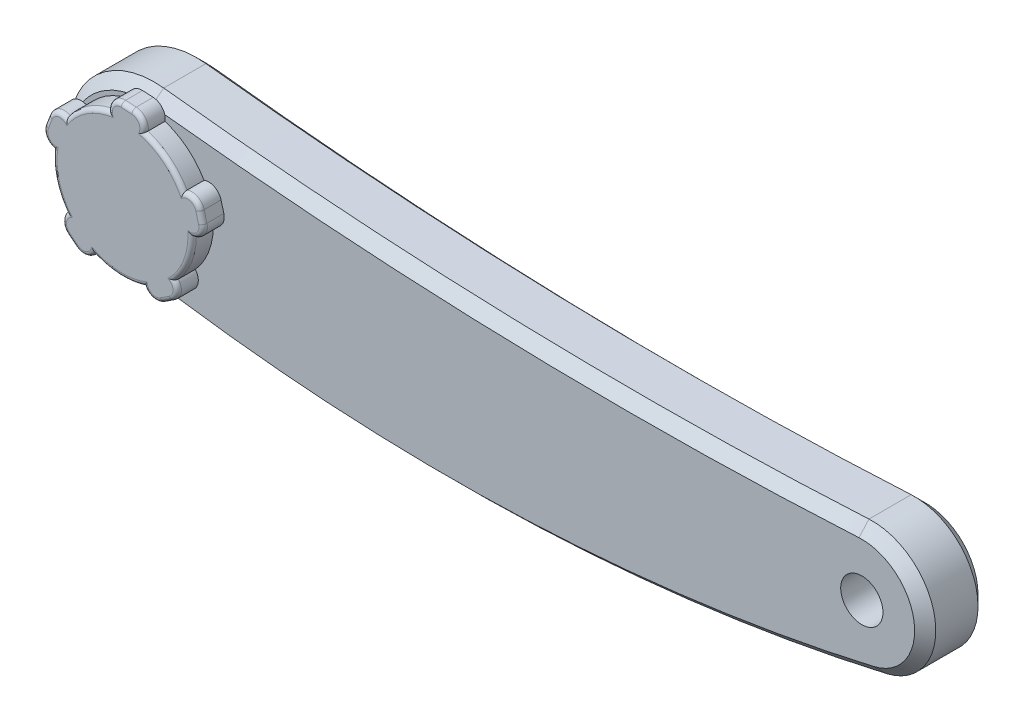
from build123d import *

# Parameters (mm, degrees)
BOSS_EXTRUDE1_DEPTH = 7.5
CHAMFER1_SIZE       = 2.5
SKETCH2_R           = 16.5
BOSS_EXTRUDE2_DEPTH = 5
BOSS_EXTRUDE3_START = -5
BOSS_EXTRUDE3_DEPTH = 5
FILLET2_R           = 1
SKETCH5_R           = 5
CUT_EXTRUDE1_DEPTH  = 10
SKETCH6_R           = 5
BOSS_EXTRUDE4_DEPTH = 10


with BuildPart() as part:
    # Sketch1 → Boss-Extrude1 (new, symmetric)
    with BuildSketch(Plane.XY):
        with BuildLine():
            ThreePointArc((-82.746539792, 19.872642429), (-104.801791361, 2.808746854), (-88.361833105, -19.715427415))
            ThreePointArc((-88.361833105, -19.715427415), (0.256800738, -25.931146508), (88.369675456, -14.61660998))
            ThreePointArc((88.369675456, -14.61660998), (99.852333231, 2.099570811), (84.186105477, 14.977902914))
            ThreePointArc((84.186105477, 14.977902914), (0.617423728, 13.934366249), (-82.746539792, 19.872642429))
        make_face()
    extrude(amount=BOSS_EXTRUDE1_DEPTH, both=True)

    # Chamfer1
    chamfer1_edges = [part.edges().sort_by_distance(p)[0] for p in [
        (0.256800738, -25.931146508, 7.5),
        (99.852333231, 2.099570811, 7.5),
        (0.617423728, 13.934366249, 7.5),
        (99.852333231, 2.099570811, -7.5),
        (0.256800738, -25.931146508, -7.5),
        (-104.801791361, 2.808746854, -7.5),
        (0.617423728, 13.934366249, -7.5),
        (-104.801791361, 2.808746854, 7.5),
    ]]
    chamfer(chamfer1_edges, length=CHAMFER1_SIZE)

    # Sketch2 → Boss-Extrude2 (add)
    with BuildSketch(Plane.XY.offset(7.5)):
        with Locations((-85, 0)):
            Circle(SKETCH2_R)
    extrude(amount=BOSS_EXTRUDE2_DEPTH)

    # Sketch4 → Boss-Extrude3 (add)
    with BuildSketch(Plane.XY.offset(12.5).offset(BOSS_EXTRUDE3_START)):
        with BuildLine():
            ThreePointArc((-85.253915773, 19.358335376), (-87.55345676, 18.462340064), (-88.403051231, 16.145254483))
            ThreePointArc((-88.403051231, 16.145254483), (-84.136456722, 16.477387323), (-79.9279524, 15.701093374))
            ThreePointArc((-79.9279524, 15.701093374), (-80.530691308, 18.094292522), (-82.723978156, 19.225746964))
            Line((-82.723978156, 19.225746964), (-85.253915773, 19.358335376))
        make_face()
        with BuildLine():
            ThreePointArc((-70.69655118, 8.225652062), (-69.750616391, 6.301293481), (-69.062223866, 4.270514244))
            Line((-69.062223866, 4.270514244), (-66.339745962, 5))
            Line((-66.339745962, 5), (-66.667593285, 6.223542865))
            ThreePointArc((-66.667593285, 6.223542865), (-68.23033271, 8.133658527), (-70.69655118, 8.225652062))
        make_face()
        with BuildLine():
            Line((-66.339745962, 5), (-69.062223866, 4.270514244))
            ThreePointArc((-69.062223866, 4.270514244), (-68.642999662, 2.167611574), (-68.500023929, 0.028100762))
            ThreePointArc((-68.500023929, 0.028100762), (-66.41021285, 1.340878735), (-66.01189864, 3.776457135))
            Line((-66.01189864, 3.776457135), (-66.339745962, 5))
        make_face()
        with BuildLine():
            ThreePointArc((-73.416033781, -15.511974356), (-72.082318874, -13.435462641), (-72.756931242, -11.061521929))
            ThreePointArc((-72.756931242, -11.061521929), (-76.013455922, -13.838064371), (-79.874501575, -15.683726148))
            ThreePointArc((-79.874501575, -15.683726148), (-77.98018839, -17.265583889), (-75.540729822, -16.891768097))
            Line((-75.540729822, -16.891768097), (-73.416033781, -15.511974356))
        make_face()
        with BuildLine():
            ThreePointArc((-96.173121868, -15.810470249), (-93.786101299, -16.437231094), (-91.736816201, -15.062048582))
            ThreePointArc((-91.736816201, -15.062048582), (-95.383786452, -12.822908364), (-98.332243835, -9.721176591))
            ThreePointArc((-98.332243835, -9.721176591), (-99.25130498, -12.011596414), (-98.141950881, -14.21614395))
            Line((-98.141950881, -14.21614395), (-96.173121868, -15.810470249))
        make_face()
        with BuildLine():
            ThreePointArc((-103.489335293, 5.740566364), (-103.347790357, 3.276695145), (-101.406650146, 1.752663965))
            ThreePointArc((-101.406650146, 1.752663965), (-100.404077037, 5.913071167), (-98.365278262, 9.675708604))
            ThreePointArc((-98.365278262, 9.675708604), (-100.827602472, 9.842009046), (-102.581442501, 8.105707948))
            Line((-102.581442501, 8.105707948), (-103.489335293, 5.740566364))
        make_face()
    extrude(amount=BOSS_EXTRUDE3_DEPTH)

    # Fillet2
    # the kernel refuses this fillet: 1 mm, written as the material it takes off along each edge
    with BuildSketch(Plane(origin=(-100.688594014, 4.665462515, 12.5), x_dir=(-0.9335804264971987, 0.3583679495453081, 0), z_dir=(0.3583679495453081, 0.9335804264971987, 0))) as fillet2_piece_1_section:
        with BuildLine():
            CenterArc((3 - FILLET2_R, -FILLET2_R), FILLET2_R, 0, 90)
            Line((3, -FILLET2_R), (3, 0))
            Line((3, 0), (3 - FILLET2_R, 0))
        make_face()
    fillet2_piece_1 = revolve(axis=Axis((-100.688594014, 4.665462515, 12.5), (0, 0, 1)), revolution_arc=144.920532816, mode=Mode.PRIVATE)
    fillet2_piece_1 = fillet2_piece_1 - Plane(origin=(-85, 0, 12.5), x_dir=(1, 0, 0), z_dir=(0, 0, -1)) * Cylinder(16.5, 13, mode=Mode.PRIVATE)
    add(fillet2_piece_1, mode=Mode.SUBTRACT)
    with BuildSketch(Plane(origin=(-99.780701222, 7.030604099, 12.5), x_dir=(0.9699592561562682, 0.24326742773494928, 0), z_dir=(0.24326742773494928, -0.9699592561562682, 0))) as fillet2_piece_2_section:
        with BuildLine():
            CenterArc((3 - FILLET2_R, -FILLET2_R), FILLET2_R, 0, 90)
            Line((3, -FILLET2_R), (3, 0))
            Line((3, 0), (3 - FILLET2_R, 0))
        make_face()
    fillet2_piece_2 = revolve(axis=Axis((-99.780701222, 7.030604099, 12.5), (0, 0, 1)), revolution_arc=144.920532816, mode=Mode.PRIVATE)
    fillet2_piece_2 = fillet2_piece_2 - Plane(origin=(-85, 0, 12.5), x_dir=(1, 0, 0), z_dir=(0, 0, -1)) * Cylinder(16.5, 13, mode=Mode.PRIVATE)
    add(fillet2_piece_2, mode=Mode.SUBTRACT)
    with BuildSketch(Plane(origin=(-102.581442501, 8.105707948, 12.5), x_dir=(0.9335804264972001, -0.3583679495453047, 0), z_dir=(-0.3583679495453047, -0.9335804264972001, 0)), Plane(origin=(-82.723978156, 19.225746964, 12.5), x_dir=(-0.05233595624295334, -0.9986295347545734, 0), z_dir=(-0.9986295347545734, 0.05233595624295334, 0)), Plane(origin=(-66.01189864, 3.776457135, 12.5), x_dir=(-0.9659258262890674, -0.25881904510252396, 0), z_dir=(-0.25881904510252396, 0.9659258262890674, 0)), Plane(origin=(-75.540729822, -16.891768097, 12.5), x_dir=(-0.5446390350150224, 0.838670567945427, 0), z_dir=(0.8386705679454272, 0.5446390350150224, 0)), Plane(origin=(-98.141950881, -14.21614395, 12.5), x_dir=(0.6293203910498405, 0.7771459614569686, 0), z_dir=(0.7771459614569686, -0.6293203910498405, 0))) as fillet2_piece_3:
        with BuildLine():
            CenterArc((FILLET2_R, -FILLET2_R), FILLET2_R, 90, 90)
            Line((0, -FILLET2_R), (0, 0))
            Line((0, 0), (FILLET2_R, 0))
        make_face()
    extrude(amount=2.533409567, mode=Mode.SUBTRACT)
    with BuildSketch(Plane(origin=(-85, 0, 12.5), x_dir=(-0.05617831402629099, 0.998420751503675, 0), z_dir=(0.998420751503675, 0.05617831402629099, 0))) as fillet2_piece_4_section:
        with BuildLine():
            CenterArc((16.5 - FILLET2_R, -FILLET2_R), FILLET2_R, 0, 90)
            Line((16.5, -FILLET2_R), (16.5, 0))
            Line((16.5, 0), (16.5 - FILLET2_R, 0))
        make_face()
    fillet2_piece_4 = revolve(axis=Axis((-85, 0, 12.5), (0, 0, 1)), revolution_arc=59.559048434, mode=Mode.PRIVATE)
    fillet2_piece_4 = fillet2_piece_4 - Plane(origin=(-99.780701222, 7.030604099, 12.5), x_dir=(0.4718076534887419, 0.8817015017053376, 0), z_dir=(0, 0, -1)) * Cylinder(3, 67, mode=Mode.PRIVATE)
    fillet2_piece_4 = fillet2_piece_4 - Plane(origin=(-85.410923642, 16.362446772, 12.5), x_dir=(0.052335956242956186, 0.9986295347545733, 0), z_dir=(0, 0, -1)) * Cylinder(3, 67, mode=Mode.PRIVATE)
    add(fillet2_piece_4, mode=Mode.SUBTRACT)
    with BuildSketch(Plane(origin=(-85.410923642, 16.362446772, 12.5), x_dir=(0.052335956242956116, 0.9986295347545732, 0), z_dir=(0.9986295347545732, -0.052335956242956116, 0))) as fillet2_piece_5_section:
        with BuildLine():
            CenterArc((3 - FILLET2_R, -FILLET2_R), FILLET2_R, 0, 90)
            Line((3, -FILLET2_R), (3, 0))
            Line((3, 0), (3 - FILLET2_R, 0))
        make_face()
    fillet2_piece_5 = revolve(axis=Axis((-85.410923642, 16.362446772, 12.5), (0, 0, 1)), revolution_arc=144.920532816, mode=Mode.PRIVATE)
    fillet2_piece_5 = fillet2_piece_5 - Plane(origin=(-85, 0, 12.5), x_dir=(1, 0, 0), z_dir=(0, 0, -1)) * Cylinder(16.5, 13, mode=Mode.PRIVATE)
    add(fillet2_piece_5, mode=Mode.SUBTRACT)
    with BuildSketch(Plane(origin=(-82.880986025, 16.22985836, 12.5), x_dir=(0.5310949663532205, -0.847312301760261, 0), z_dir=(-0.847312301760261, -0.5310949663532205, 0))) as fillet2_piece_6_section:
        with BuildLine():
            CenterArc((3 - FILLET2_R, -FILLET2_R), FILLET2_R, 0, 90)
            Line((3, -FILLET2_R), (3, 0))
            Line((3, 0), (3 - FILLET2_R, 0))
        make_face()
    fillet2_piece_6 = revolve(axis=Axis((-82.880986025, 16.22985836, 12.5), (0, 0, 1)), revolution_arc=144.920532816, mode=Mode.PRIVATE)
    fillet2_piece_6 = fillet2_piece_6 - Plane(origin=(-85, 0, 12.5), x_dir=(1, 0, 0), z_dir=(0, 0, -1)) * Cylinder(16.5, 12, mode=Mode.PRIVATE)
    add(fillet2_piece_6, mode=Mode.SUBTRACT)
    with BuildSketch(Plane(origin=(-85, 0, 12.5), x_dir=(0.9321945079724105, 0.3619577313804409, 0), z_dir=(0.3619577313804409, -0.9321945079724105, 0))) as fillet2_piece_7_section:
        with BuildLine():
            CenterArc((16.5 - FILLET2_R, -FILLET2_R), FILLET2_R, 0, 90)
            Line((16.5, -FILLET2_R), (16.5, 0))
            Line((16.5, 0), (16.5 - FILLET2_R, 0))
        make_face()
    fillet2_piece_7 = revolve(axis=Axis((-85, 0, 12.5), (0, 0, 1)), revolution_arc=59.559048434, mode=Mode.PRIVATE)
    fillet2_piece_7 = fillet2_piece_7 - Plane(origin=(-69.565370764, 5.447085729, 12.5), x_dir=(0.9659258262890714, 0.2588190451025092, 0), z_dir=(0, 0, -1)) * Cylinder(3, 67, mode=Mode.PRIVATE)
    fillet2_piece_7 = fillet2_piece_7 - Plane(origin=(-82.880986025, 16.22985836, 12.5), x_dir=(0.9843445416282657, -0.17625499529556493, 0), z_dir=(0, 0, -1)) * Cylinder(3, 67, mode=Mode.PRIVATE)
    add(fillet2_piece_7, mode=Mode.SUBTRACT)
    with BuildSketch(Plane(origin=(-69.565370764, 5.447085729, 12.5), x_dir=(0.9659258262890714, 0.2588190451025092, 0), z_dir=(0.2588190451025092, -0.9659258262890714, 0))) as fillet2_piece_8_section:
        with BuildLine():
            CenterArc((3 - FILLET2_R, -FILLET2_R), FILLET2_R, 0, 90)
            Line((3, -FILLET2_R), (3, 0))
            Line((3, 0), (3 - FILLET2_R, 0))
        make_face()
    fillet2_piece_8 = revolve(axis=Axis((-69.565370764, 5.447085729, 12.5), (0, 0, 1)), revolution_arc=144.920532816, mode=Mode.PRIVATE)
    fillet2_piece_8 = fillet2_piece_8 - Plane(origin=(-85, 0, 12.5), x_dir=(1, 0, 0), z_dir=(0, 0, -1)) * Cylinder(16.5, 12, mode=Mode.PRIVATE)
    add(fillet2_piece_8, mode=Mode.SUBTRACT)
    with BuildSketch(Plane(origin=(-68.909676119, 3, 12.5), x_dir=(-0.6417245156960635, -0.7669352293086118, 0), z_dir=(-0.7669352293086118, 0.6417245156960635, 0))) as fillet2_piece_9_section:
        with BuildLine():
            CenterArc((3 - FILLET2_R, -FILLET2_R), FILLET2_R, 0, 90)
            Line((3, -FILLET2_R), (3, 0))
            Line((3, 0), (3 - FILLET2_R, 0))
        make_face()
    fillet2_piece_9 = revolve(axis=Axis((-68.909676119, 3, 12.5), (0, 0, 1)), revolution_arc=144.920532816, mode=Mode.PRIVATE)
    fillet2_piece_9 = fillet2_piece_9 - Plane(origin=(-85, 0, 12.5), x_dir=(1, 0, 0), z_dir=(0, 0, -1)) * Cylinder(16.5, 12, mode=Mode.PRIVATE)
    add(fillet2_piece_9, mode=Mode.SUBTRACT)
    with BuildSketch(Plane(origin=(-85, 0, 12.5), x_dir=(0.9882829908626626, 0.15263266351456575, 0), z_dir=(-0.15263266351456575, 0.9882829908626626, 0))) as fillet2_piece_10_section:
        with BuildLine():
            CenterArc((16.5 - FILLET2_R, FILLET2_R), FILLET2_R, 270, 90)
            Line((16.5, FILLET2_R), (16.5, 0))
            Line((16.5, 0), (16.5 - FILLET2_R, 0))
        make_face()
    fillet2_piece_10 = revolve(axis=Axis((-85, 0, 12.5), (0, 0, -1)), revolution_arc=59.559048434, mode=Mode.PRIVATE)
    fillet2_piece_10 = fillet2_piece_10 - Plane(origin=(-75.049950886, -12.995962652, 12.5), x_dir=(0.5446390350150236, -0.8386705679454263, 0), z_dir=(0, 0, -1)) * Cylinder(3, 67, mode=Mode.PRIVATE)
    fillet2_piece_10 = fillet2_piece_10 - Plane(origin=(-68.909676119, 3, 12.5), x_dir=(0.13655072987785846, -0.9906330794849444, 0), z_dir=(0, 0, -1)) * Cylinder(3, 67, mode=Mode.PRIVATE)
    add(fillet2_piece_10, mode=Mode.SUBTRACT)
    with BuildSketch(Plane(origin=(-75.049950886, -12.995962652, 12.5), x_dir=(0.5446390350150239, -0.838670567945426, 0), z_dir=(-0.838670567945426, -0.5446390350150239, 0))) as fillet2_piece_11_section:
        with BuildLine():
            CenterArc((3 - FILLET2_R, -FILLET2_R), FILLET2_R, 0, 90)
            Line((3, -FILLET2_R), (3, 0))
            Line((3, 0), (3 - FILLET2_R, 0))
        make_face()
    fillet2_piece_11 = revolve(axis=Axis((-75.049950886, -12.995962652, 12.5), (0, 0, 1)), revolution_arc=144.920532816, mode=Mode.PRIVATE)
    fillet2_piece_11 = fillet2_piece_11 - Plane(origin=(-85, 0, 12.5), x_dir=(1, 0, 0), z_dir=(0, 0, -1)) * Cylinder(16.5, 13, mode=Mode.PRIVATE)
    add(fillet2_piece_11, mode=Mode.SUBTRACT)
    with BuildSketch(Plane(origin=(-77.174646927, -14.375756394, 12.5), x_dir=(-0.9277025284673738, 0.37332026287792297, 0), z_dir=(0.37332026287792297, 0.9277025284673738, 0))) as fillet2_piece_12_section:
        with BuildLine():
            CenterArc((3 - FILLET2_R, -FILLET2_R), FILLET2_R, 0, 90)
            Line((3, -FILLET2_R), (3, 0))
            Line((3, 0), (3 - FILLET2_R, 0))
        make_face()
    fillet2_piece_12 = revolve(axis=Axis((-77.174646927, -14.375756394, 12.5), (0, 0, 1)), revolution_arc=144.920532816, mode=Mode.PRIVATE)
    fillet2_piece_12 = fillet2_piece_12 - Plane(origin=(-85, 0, 12.5), x_dir=(1, 0, 0), z_dir=(0, 0, -1)) * Cylinder(16.5, 12, mode=Mode.PRIVATE)
    add(fillet2_piece_12, mode=Mode.SUBTRACT)
    with BuildSketch(Plane(origin=(-85, 0, 12.5), x_dir=(-0.541407782553995, -0.840760139986409, 0), z_dir=(-0.840760139986409, 0.541407782553995, 0))) as fillet2_piece_13_section:
        with BuildLine():
            CenterArc((16.5 - FILLET2_R, -FILLET2_R), FILLET2_R, 0, 90)
            Line((16.5, -FILLET2_R), (16.5, 0))
            Line((16.5, 0), (16.5 - FILLET2_R, 0))
        make_face()
    fillet2_piece_13 = revolve(axis=Axis((-85, 0, 12.5), (0, 0, 1)), revolution_arc=59.559048434, mode=Mode.PRIVATE)
    fillet2_piece_13 = fillet2_piece_13 - Plane(origin=(-94.285160694, -13.479032365, 12.5), x_dir=(-0.6293203910498562, -0.7771459614569557, 0), z_dir=(0, 0, -1)) * Cylinder(3, 67, mode=Mode.PRIVATE)
    fillet2_piece_13 = fillet2_piece_13 - Plane(origin=(-77.174646927, -14.375756394, 12.5), x_dir=(-0.8999515493751495, -0.4359899182059923, 0), z_dir=(0, 0, -1)) * Cylinder(3, 67, mode=Mode.PRIVATE)
    add(fillet2_piece_13, mode=Mode.SUBTRACT)
    with BuildSketch(Plane(origin=(-94.285160694, -13.479032365, 12.5), x_dir=(-0.6293203910498565, -0.7771459614569555, 0), z_dir=(-0.7771459614569555, 0.6293203910498565, 0))) as fillet2_piece_14_section:
        with BuildLine():
            CenterArc((3 - FILLET2_R, -FILLET2_R), FILLET2_R, 0, 90)
            Line((3 - FILLET2_R, 0), (3, 0))
            Line((3, 0), (3, -FILLET2_R))
        make_face()
    fillet2_piece_14 = revolve(axis=Axis((-94.285160694, -13.479032365, 12.5), (0, 0, 1)), revolution_arc=144.920532816, mode=Mode.PRIVATE)
    fillet2_piece_14 = fillet2_piece_14 - Plane(origin=(-85, 0, 12.5), x_dir=(1, 0, 0), z_dir=(0, 0, -1)) * Cylinder(16.5, 12, mode=Mode.PRIVATE)
    add(fillet2_piece_14, mode=Mode.SUBTRACT)
    with BuildSketch(Plane(origin=(-96.253989708, -11.884706065, 12.5), x_dir=(0.06837282165402307, 0.9976598404561883, 0), z_dir=(0.9976598404561883, -0.06837282165402307, 0))) as fillet2_piece_15_section:
        with BuildLine():
            CenterArc((3 - FILLET2_R, -FILLET2_R), FILLET2_R, 0, 90)
            Line((3, -FILLET2_R), (3, 0))
            Line((3, 0), (3 - FILLET2_R, 0))
        make_face()
    fillet2_piece_15 = revolve(axis=Axis((-96.253989708, -11.884706065, 12.5), (0, 0, 1)), revolution_arc=144.920532816, mode=Mode.PRIVATE)
    fillet2_piece_15 = fillet2_piece_15 - Plane(origin=(-85, 0, 12.5), x_dir=(1, 0, 0), z_dir=(0, 0, -1)) * Cylinder(16.5, 13, mode=Mode.PRIVATE)
    add(fillet2_piece_15, mode=Mode.SUBTRACT)
    with BuildSketch(Plane(origin=(-85, 0, 12.5), x_dir=(-0.9669146154713397, 0.2551002281220293, 0), z_dir=(0.2551002281220293, 0.9669146154713397, 0))) as fillet2_piece_16_section:
        with BuildLine():
            CenterArc((16.5 - FILLET2_R, -FILLET2_R), FILLET2_R, 0, 90)
            Line((16.5, -FILLET2_R), (16.5, 0))
            Line((16.5, 0), (16.5 - FILLET2_R, 0))
        make_face()
    fillet2_piece_16 = revolve(axis=Axis((-85, 0, 12.5), (0, 0, 1)), revolution_arc=59.559048434, mode=Mode.PRIVATE)
    fillet2_piece_16 = fillet2_piece_16 - Plane(origin=(-96.253989708, -11.884706065, 12.5), x_dir=(-0.6927513756198016, 0.7211764912813456, 0), z_dir=(0, 0, -1)) * Cylinder(3, 67, mode=Mode.PRIVATE)
    fillet2_piece_16 = fillet2_piece_16 - Plane(origin=(-100.688594014, 4.665462515, 12.5), x_dir=(-0.9335804264971987, 0.3583679495453081, 0), z_dir=(0, 0, -1)) * Cylinder(3, 67, mode=Mode.PRIVATE)
    add(fillet2_piece_16, mode=Mode.SUBTRACT)
    with BuildSketch(Plane(origin=(-100.688594014, 4.665462515, 12.5), x_dir=(-0.9335804264971987, 0.3583679495453081, 0), z_dir=(0.3583679495453081, 0.9335804264971987, 0))) as fillet2_piece_17a_section:
        with BuildLine():
            CenterArc((3 - FILLET2_R, -FILLET2_R), FILLET2_R, 0, 90)
            Line((3, -FILLET2_R), (3, 0))
            Line((3, 0), (3 - FILLET2_R, 0))
        make_face()
    fillet2_piece_17a = revolve(axis=Axis((-100.688594014, 4.665462515, 12.5), (0, 0, 1)), revolution_arc=144.920532816, mode=Mode.PRIVATE)
    fillet2_piece_17a = fillet2_piece_17a & Plane(origin=(-85, 0, 12.5), x_dir=(1, 0, 0), z_dir=(0, 0, -1)) * Cylinder(16.5, 13, mode=Mode.PRIVATE)
    with BuildSketch(Plane(origin=(-85, 0, 12.5), x_dir=(-0.9669146154713397, 0.2551002281220293, 0), z_dir=(0.2551002281220293, 0.9669146154713397, 0))) as fillet2_piece_17b_section:
        with BuildLine():
            CenterArc((16.5 - FILLET2_R, -FILLET2_R), FILLET2_R, 0, 90)
            Line((16.5, -FILLET2_R), (16.5, 0))
            Line((16.5, 0), (16.5 - FILLET2_R, 0))
        make_face()
    fillet2_piece_17b = revolve(axis=Axis((-85, 0, 12.5), (0, 0, 1)), revolution_arc=59.559048434, mode=Mode.PRIVATE)
    fillet2_piece_17b = fillet2_piece_17b & Plane(origin=(-100.688594014, 4.665462515, 12.5), x_dir=(-0.9335804264971987, 0.3583679495453081, 0), z_dir=(0, 0, -1)) * Cylinder(3, 67, mode=Mode.PRIVATE)
    fillet2_piece_17 = fillet2_piece_17a & fillet2_piece_17b
    add(fillet2_piece_17, mode=Mode.SUBTRACT)
    with BuildSketch(Plane(origin=(-85, 0, 12.5), x_dir=(-0.05617831402629099, 0.998420751503675, 0), z_dir=(0.998420751503675, 0.05617831402629099, 0))) as fillet2_piece_18a_section:
        with BuildLine():
            CenterArc((16.5 - FILLET2_R, -FILLET2_R), FILLET2_R, 0, 90)
            Line((16.5, -FILLET2_R), (16.5, 0))
            Line((16.5, 0), (16.5 - FILLET2_R, 0))
        make_face()
    fillet2_piece_18a = revolve(axis=Axis((-85, 0, 12.5), (0, 0, 1)), revolution_arc=59.559048434, mode=Mode.PRIVATE)
    fillet2_piece_18a = fillet2_piece_18a & Plane(origin=(-99.780701222, 7.030604099, 12.5), x_dir=(0.4718076534887419, 0.8817015017053376, 0), z_dir=(0, 0, -1)) * Cylinder(3, 67, mode=Mode.PRIVATE)
    with BuildSketch(Plane(origin=(-99.780701222, 7.030604099, 12.5), x_dir=(0.9699592561562682, 0.24326742773494928, 0), z_dir=(0.24326742773494928, -0.9699592561562682, 0))) as fillet2_piece_18b_section:
        with BuildLine():
            CenterArc((3 - FILLET2_R, -FILLET2_R), FILLET2_R, 0, 90)
            Line((3, -FILLET2_R), (3, 0))
            Line((3, 0), (3 - FILLET2_R, 0))
        make_face()
    fillet2_piece_18b = revolve(axis=Axis((-99.780701222, 7.030604099, 12.5), (0, 0, 1)), revolution_arc=144.920532816, mode=Mode.PRIVATE)
    fillet2_piece_18b = fillet2_piece_18b & Plane(origin=(-85, 0, 12.5), x_dir=(1, 0, 0), z_dir=(0, 0, -1)) * Cylinder(16.5, 13, mode=Mode.PRIVATE)
    fillet2_piece_18 = fillet2_piece_18a & fillet2_piece_18b
    add(fillet2_piece_18, mode=Mode.SUBTRACT)
    with BuildSketch(Plane(origin=(-85.410923642, 16.362446772, 12.5), x_dir=(0.052335956242956116, 0.9986295347545732, 0), z_dir=(0.9986295347545732, -0.052335956242956116, 0))) as fillet2_piece_19a_section:
        with BuildLine():
            CenterArc((3 - FILLET2_R, -FILLET2_R), FILLET2_R, 0, 90)
            Line((3, -FILLET2_R), (3, 0))
            Line((3, 0), (3 - FILLET2_R, 0))
        make_face()
    fillet2_piece_19a = revolve(axis=Axis((-85.410923642, 16.362446772, 12.5), (0, 0, 1)), revolution_arc=144.920532816, mode=Mode.PRIVATE)
    fillet2_piece_19a = fillet2_piece_19a & Plane(origin=(-85, 0, 12.5), x_dir=(1, 0, 0), z_dir=(0, 0, -1)) * Cylinder(16.5, 13, mode=Mode.PRIVATE)
    with BuildSketch(Plane(origin=(-85, 0, 12.5), x_dir=(-0.05617831402629099, 0.998420751503675, 0), z_dir=(0.998420751503675, 0.05617831402629099, 0))) as fillet2_piece_19b_section:
        with BuildLine():
            CenterArc((16.5 - FILLET2_R, -FILLET2_R), FILLET2_R, 0, 90)
            Line((16.5, -FILLET2_R), (16.5, 0))
            Line((16.5, 0), (16.5 - FILLET2_R, 0))
        make_face()
    fillet2_piece_19b = revolve(axis=Axis((-85, 0, 12.5), (0, 0, 1)), revolution_arc=59.559048434, mode=Mode.PRIVATE)
    fillet2_piece_19b = fillet2_piece_19b & Plane(origin=(-85.410923642, 16.362446772, 12.5), x_dir=(0.052335956242956186, 0.9986295347545733, 0), z_dir=(0, 0, -1)) * Cylinder(3, 67, mode=Mode.PRIVATE)
    fillet2_piece_19 = fillet2_piece_19a & fillet2_piece_19b
    add(fillet2_piece_19, mode=Mode.SUBTRACT)
    with BuildSketch(Plane(origin=(-85, 0, 12.5), x_dir=(0.9321945079724105, 0.3619577313804409, 0), z_dir=(0.3619577313804409, -0.9321945079724105, 0))) as fillet2_piece_20a_section:
        with BuildLine():
            CenterArc((16.5 - FILLET2_R, -FILLET2_R), FILLET2_R, 0, 90)
            Line((16.5, -FILLET2_R), (16.5, 0))
            Line((16.5, 0), (16.5 - FILLET2_R, 0))
        make_face()
    fillet2_piece_20a = revolve(axis=Axis((-85, 0, 12.5), (0, 0, 1)), revolution_arc=59.559048434, mode=Mode.PRIVATE)
    fillet2_piece_20a = fillet2_piece_20a & Plane(origin=(-82.880986025, 16.22985836, 12.5), x_dir=(0.9843445416282657, -0.17625499529556493, 0), z_dir=(0, 0, -1)) * Cylinder(3, 67, mode=Mode.PRIVATE)
    with BuildSketch(Plane(origin=(-82.880986025, 16.22985836, 12.5), x_dir=(0.5310949663532205, -0.847312301760261, 0), z_dir=(-0.847312301760261, -0.5310949663532205, 0))) as fillet2_piece_20b_section:
        with BuildLine():
            CenterArc((3 - FILLET2_R, -FILLET2_R), FILLET2_R, 0, 90)
            Line((3, -FILLET2_R), (3, 0))
            Line((3, 0), (3 - FILLET2_R, 0))
        make_face()
    fillet2_piece_20b = revolve(axis=Axis((-82.880986025, 16.22985836, 12.5), (0, 0, 1)), revolution_arc=144.920532816, mode=Mode.PRIVATE)
    fillet2_piece_20b = fillet2_piece_20b & Plane(origin=(-85, 0, 12.5), x_dir=(1, 0, 0), z_dir=(0, 0, -1)) * Cylinder(16.5, 12, mode=Mode.PRIVATE)
    fillet2_piece_20 = fillet2_piece_20a & fillet2_piece_20b
    add(fillet2_piece_20, mode=Mode.SUBTRACT)
    with BuildSketch(Plane(origin=(-69.565370764, 5.447085729, 12.5), x_dir=(0.9659258262890714, 0.2588190451025092, 0), z_dir=(0.2588190451025092, -0.9659258262890714, 0))) as fillet2_piece_21a_section:
        with BuildLine():
            CenterArc((3 - FILLET2_R, -FILLET2_R), FILLET2_R, 0, 90)
            Line((3, -FILLET2_R), (3, 0))
            Line((3, 0), (3 - FILLET2_R, 0))
        make_face()
    fillet2_piece_21a = revolve(axis=Axis((-69.565370764, 5.447085729, 12.5), (0, 0, 1)), revolution_arc=144.920532816, mode=Mode.PRIVATE)
    fillet2_piece_21a = fillet2_piece_21a & Plane(origin=(-85, 0, 12.5), x_dir=(1, 0, 0), z_dir=(0, 0, -1)) * Cylinder(16.5, 12, mode=Mode.PRIVATE)
    with BuildSketch(Plane(origin=(-85, 0, 12.5), x_dir=(0.9321945079724105, 0.3619577313804409, 0), z_dir=(0.3619577313804409, -0.9321945079724105, 0))) as fillet2_piece_21b_section:
        with BuildLine():
            CenterArc((16.5 - FILLET2_R, -FILLET2_R), FILLET2_R, 0, 90)
            Line((16.5, -FILLET2_R), (16.5, 0))
            Line((16.5, 0), (16.5 - FILLET2_R, 0))
        make_face()
    fillet2_piece_21b = revolve(axis=Axis((-85, 0, 12.5), (0, 0, 1)), revolution_arc=59.559048434, mode=Mode.PRIVATE)
    fillet2_piece_21b = fillet2_piece_21b & Plane(origin=(-69.565370764, 5.447085729, 12.5), x_dir=(0.9659258262890714, 0.2588190451025092, 0), z_dir=(0, 0, -1)) * Cylinder(3, 67, mode=Mode.PRIVATE)
    fillet2_piece_21 = fillet2_piece_21a & fillet2_piece_21b
    add(fillet2_piece_21, mode=Mode.SUBTRACT)
    with BuildSketch(Plane(origin=(-85, 0, 12.5), x_dir=(0.9882829908626626, 0.15263266351456575, 0), z_dir=(-0.15263266351456575, 0.9882829908626626, 0))) as fillet2_piece_22a_section:
        with BuildLine():
            CenterArc((16.5 - FILLET2_R, FILLET2_R), FILLET2_R, 270, 90)
            Line((16.5, FILLET2_R), (16.5, 0))
            Line((16.5, 0), (16.5 - FILLET2_R, 0))
        make_face()
    fillet2_piece_22a = revolve(axis=Axis((-85, 0, 12.5), (0, 0, -1)), revolution_arc=59.559048434, mode=Mode.PRIVATE)
    fillet2_piece_22a = fillet2_piece_22a & Plane(origin=(-68.909676119, 3, 12.5), x_dir=(0.13655072987785846, -0.9906330794849444, 0), z_dir=(0, 0, -1)) * Cylinder(3, 67, mode=Mode.PRIVATE)
    with BuildSketch(Plane(origin=(-68.909676119, 3, 12.5), x_dir=(-0.6417245156960635, -0.7669352293086118, 0), z_dir=(-0.7669352293086118, 0.6417245156960635, 0))) as fillet2_piece_22b_section:
        with BuildLine():
            CenterArc((3 - FILLET2_R, -FILLET2_R), FILLET2_R, 0, 90)
            Line((3, -FILLET2_R), (3, 0))
            Line((3, 0), (3 - FILLET2_R, 0))
        make_face()
    fillet2_piece_22b = revolve(axis=Axis((-68.909676119, 3, 12.5), (0, 0, 1)), revolution_arc=144.920532816, mode=Mode.PRIVATE)
    fillet2_piece_22b = fillet2_piece_22b & Plane(origin=(-85, 0, 12.5), x_dir=(1, 0, 0), z_dir=(0, 0, -1)) * Cylinder(16.5, 12, mode=Mode.PRIVATE)
    fillet2_piece_22 = fillet2_piece_22a & fillet2_piece_22b
    add(fillet2_piece_22, mode=Mode.SUBTRACT)
    with BuildSketch(Plane(origin=(-75.049950886, -12.995962652, 12.5), x_dir=(0.5446390350150239, -0.838670567945426, 0), z_dir=(-0.838670567945426, -0.5446390350150239, 0))) as fillet2_piece_23a_section:
        with BuildLine():
            CenterArc((3 - FILLET2_R, -FILLET2_R), FILLET2_R, 0, 90)
            Line((3, -FILLET2_R), (3, 0))
            Line((3, 0), (3 - FILLET2_R, 0))
        make_face()
    fillet2_piece_23a = revolve(axis=Axis((-75.049950886, -12.995962652, 12.5), (0, 0, 1)), revolution_arc=144.920532816, mode=Mode.PRIVATE)
    fillet2_piece_23a = fillet2_piece_23a & Plane(origin=(-85, 0, 12.5), x_dir=(1, 0, 0), z_dir=(0, 0, -1)) * Cylinder(16.5, 13, mode=Mode.PRIVATE)
    with BuildSketch(Plane(origin=(-85, 0, 12.5), x_dir=(0.9882829908626626, 0.15263266351456575, 0), z_dir=(-0.15263266351456575, 0.9882829908626626, 0))) as fillet2_piece_23b_section:
        with BuildLine():
            CenterArc((16.5 - FILLET2_R, FILLET2_R), FILLET2_R, 270, 90)
            Line((16.5, FILLET2_R), (16.5, 0))
            Line((16.5, 0), (16.5 - FILLET2_R, 0))
        make_face()
    fillet2_piece_23b = revolve(axis=Axis((-85, 0, 12.5), (0, 0, -1)), revolution_arc=59.559048434, mode=Mode.PRIVATE)
    fillet2_piece_23b = fillet2_piece_23b & Plane(origin=(-75.049950886, -12.995962652, 12.5), x_dir=(0.5446390350150236, -0.8386705679454263, 0), z_dir=(0, 0, -1)) * Cylinder(3, 67, mode=Mode.PRIVATE)
    fillet2_piece_23 = fillet2_piece_23a & fillet2_piece_23b
    add(fillet2_piece_23, mode=Mode.SUBTRACT)
    with BuildSketch(Plane(origin=(-85, 0, 12.5), x_dir=(-0.541407782553995, -0.840760139986409, 0), z_dir=(-0.840760139986409, 0.541407782553995, 0))) as fillet2_piece_24a_section:
        with BuildLine():
            CenterArc((16.5 - FILLET2_R, -FILLET2_R), FILLET2_R, 0, 90)
            Line((16.5, -FILLET2_R), (16.5, 0))
            Line((16.5, 0), (16.5 - FILLET2_R, 0))
        make_face()
    fillet2_piece_24a = revolve(axis=Axis((-85, 0, 12.5), (0, 0, 1)), revolution_arc=59.559048434, mode=Mode.PRIVATE)
    fillet2_piece_24a = fillet2_piece_24a & Plane(origin=(-77.174646927, -14.375756394, 12.5), x_dir=(-0.8999515493751495, -0.4359899182059923, 0), z_dir=(0, 0, -1)) * Cylinder(3, 67, mode=Mode.PRIVATE)
    with BuildSketch(Plane(origin=(-77.174646927, -14.375756394, 12.5), x_dir=(-0.9277025284673738, 0.37332026287792297, 0), z_dir=(0.37332026287792297, 0.9277025284673738, 0))) as fillet2_piece_24b_section:
        with BuildLine():
            CenterArc((3 - FILLET2_R, -FILLET2_R), FILLET2_R, 0, 90)
            Line((3, -FILLET2_R), (3, 0))
            Line((3, 0), (3 - FILLET2_R, 0))
        make_face()
    fillet2_piece_24b = revolve(axis=Axis((-77.174646927, -14.375756394, 12.5), (0, 0, 1)), revolution_arc=144.920532816, mode=Mode.PRIVATE)
    fillet2_piece_24b = fillet2_piece_24b & Plane(origin=(-85, 0, 12.5), x_dir=(1, 0, 0), z_dir=(0, 0, -1)) * Cylinder(16.5, 12, mode=Mode.PRIVATE)
    fillet2_piece_24 = fillet2_piece_24a & fillet2_piece_24b
    add(fillet2_piece_24, mode=Mode.SUBTRACT)
    with BuildSketch(Plane(origin=(-94.285160694, -13.479032365, 12.5), x_dir=(-0.6293203910498565, -0.7771459614569555, 0), z_dir=(-0.7771459614569555, 0.6293203910498565, 0))) as fillet2_piece_25a_section:
        with BuildLine():
            CenterArc((3 - FILLET2_R, -FILLET2_R), FILLET2_R, 0, 90)
            Line((3 - FILLET2_R, 0), (3, 0))
            Line((3, 0), (3, -FILLET2_R))
        make_face()
    fillet2_piece_25a = revolve(axis=Axis((-94.285160694, -13.479032365, 12.5), (0, 0, 1)), revolution_arc=144.920532816, mode=Mode.PRIVATE)
    fillet2_piece_25a = fillet2_piece_25a & Plane(origin=(-85, 0, 12.5), x_dir=(1, 0, 0), z_dir=(0, 0, -1)) * Cylinder(16.5, 12, mode=Mode.PRIVATE)
    with BuildSketch(Plane(origin=(-85, 0, 12.5), x_dir=(-0.541407782553995, -0.840760139986409, 0), z_dir=(-0.840760139986409, 0.541407782553995, 0))) as fillet2_piece_25b_section:
        with BuildLine():
            CenterArc((16.5 - FILLET2_R, -FILLET2_R), FILLET2_R, 0, 90)
            Line((16.5, -FILLET2_R), (16.5, 0))
            Line((16.5, 0), (16.5 - FILLET2_R, 0))
        make_face()
    fillet2_piece_25b = revolve(axis=Axis((-85, 0, 12.5), (0, 0, 1)), revolution_arc=59.559048434, mode=Mode.PRIVATE)
    fillet2_piece_25b = fillet2_piece_25b & Plane(origin=(-94.285160694, -13.479032365, 12.5), x_dir=(-0.6293203910498562, -0.7771459614569557, 0), z_dir=(0, 0, -1)) * Cylinder(3, 67, mode=Mode.PRIVATE)
    fillet2_piece_25 = fillet2_piece_25a & fillet2_piece_25b
    add(fillet2_piece_25, mode=Mode.SUBTRACT)
    with BuildSketch(Plane(origin=(-96.253989708, -11.884706065, 12.5), x_dir=(0.06837282165402307, 0.9976598404561883, 0), z_dir=(0.9976598404561883, -0.06837282165402307, 0))) as fillet2_piece_26a_section:
        with BuildLine():
            CenterArc((3 - FILLET2_R, -FILLET2_R), FILLET2_R, 0, 90)
            Line((3, -FILLET2_R), (3, 0))
            Line((3, 0), (3 - FILLET2_R, 0))
        make_face()
    fillet2_piece_26a = revolve(axis=Axis((-96.253989708, -11.884706065, 12.5), (0, 0, 1)), revolution_arc=144.920532816, mode=Mode.PRIVATE)
    fillet2_piece_26a = fillet2_piece_26a & Plane(origin=(-85, 0, 12.5), x_dir=(1, 0, 0), z_dir=(0, 0, -1)) * Cylinder(16.5, 13, mode=Mode.PRIVATE)
    with BuildSketch(Plane(origin=(-85, 0, 12.5), x_dir=(-0.9669146154713397, 0.2551002281220293, 0), z_dir=(0.2551002281220293, 0.9669146154713397, 0))) as fillet2_piece_26b_section:
        with BuildLine():
            CenterArc((16.5 - FILLET2_R, -FILLET2_R), FILLET2_R, 0, 90)
            Line((16.5, -FILLET2_R), (16.5, 0))
            Line((16.5, 0), (16.5 - FILLET2_R, 0))
        make_face()
    fillet2_piece_26b = revolve(axis=Axis((-85, 0, 12.5), (0, 0, 1)), revolution_arc=59.559048434, mode=Mode.PRIVATE)
    fillet2_piece_26b = fillet2_piece_26b & Plane(origin=(-96.253989708, -11.884706065, 12.5), x_dir=(-0.6927513756198016, 0.7211764912813456, 0), z_dir=(0, 0, -1)) * Cylinder(3, 67, mode=Mode.PRIVATE)
    fillet2_piece_26 = fillet2_piece_26a & fillet2_piece_26b
    add(fillet2_piece_26, mode=Mode.SUBTRACT)

    # Sketch5 → Cut-Extrude1 (cut)
    with BuildSketch(Plane.XY.offset(7.5)):
        with Locations((85, 0)):
            Circle(SKETCH5_R)
    extrude(amount=-CUT_EXTRUDE1_DEPTH, mode=Mode.SUBTRACT)

    # Sketch6 → Boss-Extrude4 (add)
    with BuildSketch(Plane(origin=(0, 0, -7.5), x_dir=(-1, 0, 0), z_dir=(0, 0, -1))):
        with Locations(Location((85, 0, 0), (0, 0, 180))):
            Circle(SKETCH6_R)
    extrude(amount=BOSS_EXTRUDE4_DEPTH)


solid = part.part
